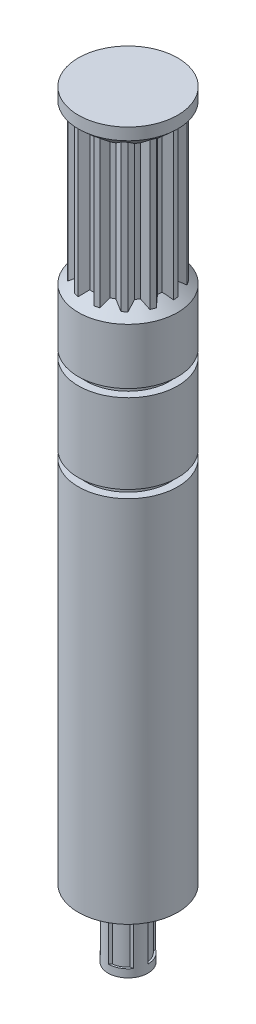
from build123d import *

# Parameters (mm, degrees)
BOSS_EXTRUDE1_DEPTH = 40
CIRPATTERN1_COUNT   = 13
CAVITY4_START       = 2
CAVITY4_OUTLINE_R   = 12.5
CAVITY4_DEPTH       = 15


# Read off the part's stored shape, not the designer's step: Cavity4
with BuildPart() as part:
    # Sketch1 → Revolve1 (revolve)
    with BuildSketch(Plane(origin=(0, 0, 0), x_dir=(0, 0, -1), z_dir=(1, 0, 0))):
        Polygon((9.15, 184.76), (12.5, 187.76), (12.5, 190.76), (0, 190.76), (0, 0), (5, 0), (5, 3), (12.5, 3), (12.5, 109.76), (10.5, 109.76), (10.5, 111.76), (12.5, 111.76), (12.5, 131.76), (10.5, 131.76), (10.5, 133.76), (12.5, 133.76), (12.5, 147.76), (9.15, 150.76), align=None)
    revolve(axis=Axis((0, 0, 0), (0, 1, 0)))

    # Sketch2 → Boss-Extrude1 (add)
    with BuildSketch(Plane(origin=(0, 187.76, 0), x_dir=(1, 0, 0), z_dir=(0, 1, 0))):
        Polygon((-1.985866, 8.5), (1.924134, 8.5), (0.604134, 10.786307), (-0.665866, 10.786307), align=None)
    boss_extrude1 = extrude(amount=-BOSS_EXTRUDE1_DEPTH)

    # CirPattern1: Boss-Extrude1 ×13 about axis
    cirpattern1_axis = Axis((0, 0, 0), (0, 1, 0))
    for i in range(1, CIRPATTERN1_COUNT):
        add(boss_extrude1.rotate(cirpattern1_axis, i * 360 / CIRPATTERN1_COUNT))

    # Cavity4 outline → Cavity4 (cut)
    with BuildSketch(Plane(origin=(0, 0, 0), x_dir=(1, 0, 0), z_dir=(0, 1, 0)).offset(CAVITY4_START)):
        Circle(CAVITY4_OUTLINE_R)
        with BuildLine():
            ThreePointArc((-3.437663, 2.903872), (-2.142478, 3.957245), (-0.552415, 4.465964))
            Line((-0.552415, 4.465964), (-0.023411, 4.999945))
            ThreePointArc((-0.023411, 4.999945), (1.425815, 4.792395), (2.752802, 4.173977))
            Line((2.752802, 4.173977), (2.903872, 3.437663))
            ThreePointArc((2.903872, 3.437663), (3.957245, 2.142478), (4.465964, 0.552415))
            Line((4.465964, 0.552415), (4.999945, 0.023411))
            ThreePointArc((4.999945, 0.023411), (4.792395, -1.425815), (4.173977, -2.752802))
            Line((4.173977, -2.752802), (3.437663, -2.903872))
            ThreePointArc((3.437663, -2.903872), (2.142478, -3.957245), (0.552415, -4.465964))
            Line((0.552415, -4.465964), (0.023411, -4.999945))
            ThreePointArc((0.023411, -4.999945), (-1.425815, -4.792395), (-2.752802, -4.173977))
            Line((-2.752802, -4.173977), (-2.903872, -3.437663))
            ThreePointArc((-2.903872, -3.437663), (-3.957245, -2.142478), (-4.465964, -0.552415))
            Line((-4.465964, -0.552415), (-4.999945, -0.023411))
            ThreePointArc((-4.999945, -0.023411), (-4.792395, 1.425815), (-4.173977, 2.752802))
            Line((-4.173977, 2.752802), (-3.437663, 2.903872))
        make_face(mode=Mode.SUBTRACT)
    extrude(amount=CAVITY4_DEPTH, mode=Mode.SUBTRACT)


solid = part.part
